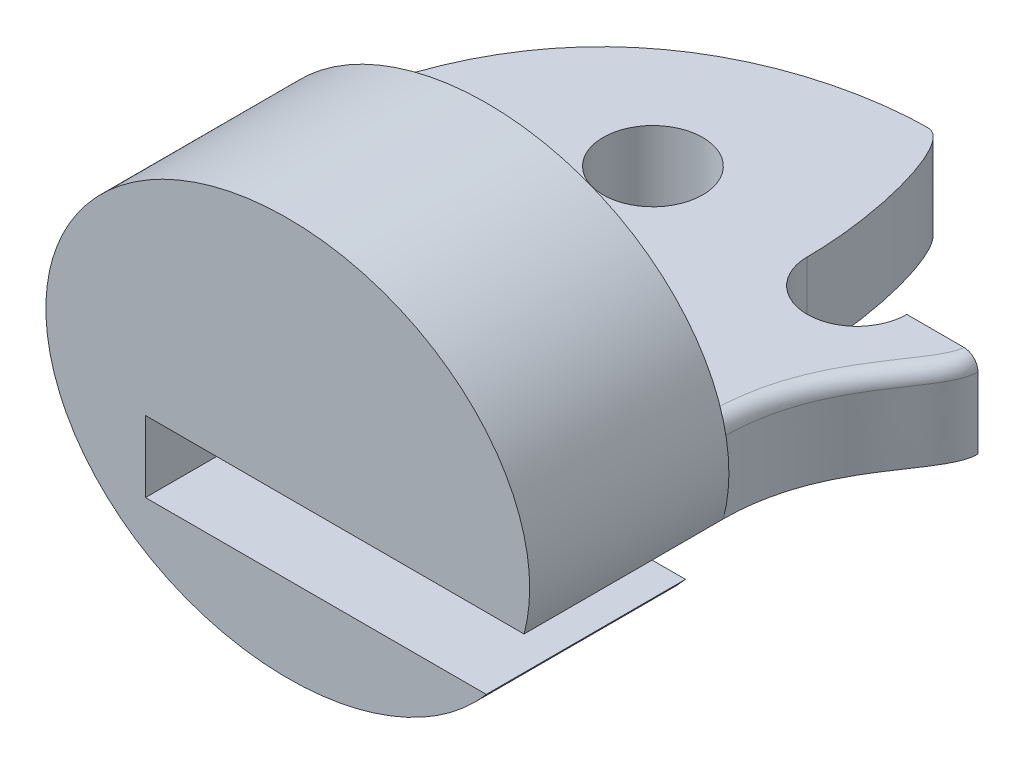
from build123d import *

# Parameters (mm, degrees)
SKETCH1_RX          = 8.5
SKETCH1_RY          = 7
BOSS_EXTRUDE1_DEPTH = 7
SKETCH3_W           = 13.302553701
SKETCH3_H           = 2.5
CUT_EXTRUDE1_DEPTH  = 7
SKETCH4_R           = 1.75
BOSS_EXTRUDE3_DEPTH = 3
CUT_EXTRUDE2_DEPTH  = 10
FILLET1_R           = 0.5
SCALE1_SCALE        = 2


with BuildPart() as part:
    # Sketch1 → Boss-Extrude1 (new body)
    with BuildSketch(Plane.XY):
        with Locations((0, 0)):
            Ellipse(SKETCH1_RX, SKETCH1_RY)
    extrude(amount=BOSS_EXTRUDE1_DEPTH)

    # Sketch3 → Cut-Extrude1 (cut)
    with BuildSketch(Plane.XY.offset(7)):
        with Locations((1.651276851, -2.75)):
            Rectangle(SKETCH3_W, SKETCH3_H)
    extrude(amount=-CUT_EXTRUDE1_DEPTH, mode=Mode.SUBTRACT)

    # Sketch4 → Boss-Extrude3 (add)
    with BuildSketch(Plane(origin=(0, -1.5, 0), x_dir=(-1, 0, 0), z_dir=(0, -1, 0))):
        with BuildLine():
            Line((-8.302553701, 6.45), (-10.802553701, 6.45))
            add(Edge.make_bspline(
                [(-8.302553701, 0), (-8.302553701, 3.575485031), (-10.802553701, 5.135257865), (-10.802553701, 6.45)],
                knots=[0, 0, 0, 0, 0.74548132, 0.74548132, 0.74548132, 0.74548132], degree=3))
            Line((-8.302553701, 0), (8.5, 0))
            add(Edge.make_bspline(
                [(8.5, 0), (8.5, 10.613387886), (0.460909778, 12.5), (-3, 12.5)],
                knots=[0, 0, 0, 0, 0.609858284, 0.609858284, 0.609858284, 0.609858284], degree=3))
            add(Edge.make_bspline(
                [(-4.802553701, 6.45), (-4.802553701, 9.055292156), (-3.876094367, 12.5), (-3, 12.5)],
                knots=[0, 0, 0, 0, 0.703518023, 0.703518023, 0.703518023, 0.703518023], degree=3))
            ThreePointArc((-4.802553701, 6.45), (-6.552553701, 4.7), (-8.302553701, 6.45))
        make_face()
        with Locations((0.67, 6.5)):
            Circle(SKETCH4_R, mode=Mode.SUBTRACT)
        with Locations((5.5, 3)):
            Circle(SKETCH4_R, mode=Mode.SUBTRACT)
    extrude(amount=-BOSS_EXTRUDE3_DEPTH)

    # Sketch5 → Cut-Extrude2 (cut)
    with BuildSketch(Plane(origin=(0, 0, 0), x_dir=(-1, 0, 0), z_dir=(0, 0, -1))):
        with BuildLine():
            Line((7.715910661, 2.936517276), (9.418477353, 2.936517276))
            Line((9.418477353, 2.936517276), (9.418477353, -1.069495705))
            Line((9.418477353, -1.069495705), (8.400205207, -1.069495705))
            add(Edge.make_bspline(
                [(8.400205207, -1.069495705), (8.79219322, 1.018558972), (7.715910661, 2.936517276)],
                knots=[6.129799457, 6.129799457, 6.129799457, 6.716082467, 6.716082467, 6.716082467], degree=2, weights=[1, 0.957340828, 1]))
        make_face()
    extrude(amount=CUT_EXTRUDE2_DEPTH, mode=Mode.SUBTRACT)

    # Fillet1
    fillet1_edges = [part.edges().sort_by_distance(p)[0] for p in [
        (9.151569491, 1.5, -3.377856468),
    ]]
    fillet(fillet1_edges, radius=FILLET1_R)


with BuildPart() as part_1:
    # Scale1: scaled about (-0.045790551, 0.403952777, 1.09266448)
    add(part.part.scale(SCALE1_SCALE).moved(Location((0.045790551, -0.403952777, -1.09266448))))


solid = part_1.part
